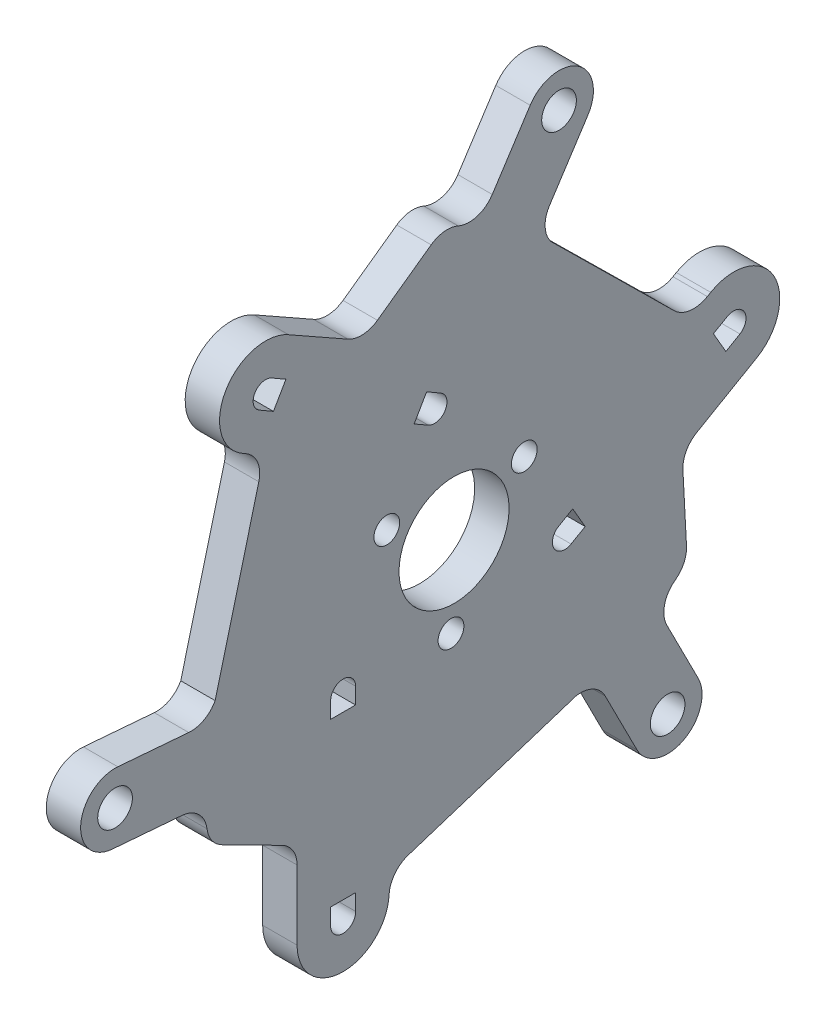
from build123d import *

# Parameters (mm, degrees)
BOSS_EXTRUDE1_DEPTH = 3.175
SKETCH8_W           = 24
SKETCH8_H           = 4.7625
BOSS_EXTRUDE2_DEPTH = 3.175
BOSS_EXTRUDE3_DEPTH = 3.175
CUT_EXTRUDE8_DEPTH  = 3.175
CUT_EXTRUDE7_DEPTH  = 3.175
FILLET1_R           = 2.54
FILLET2_R           = 2.54
SKETCH13_R          = 1.190625
CUT_EXTRUDE9_DEPTH  = 3.175
SKETCH17_R          = 1.6
BOSS_EXTRUDE5_DEPTH = 3.175
FILLET4_R           = 2.54
SKETCH20_R          = 5.08
CUT_EXTRUDE12_DEPTH = 70.976978338


with BuildPart() as part:
    # Sketch1 → Boss-Extrude1 (new body)
    with BuildSketch(Plane(origin=(0, 0, 0), x_dir=(0, 0, -1), z_dir=(1, 0, 0))):
        Polygon((43.890597967, 11.483842091), (31.890597967, 32.268451781), (22.25, 38.538130468), (44.5, 0), align=None)
        Polygon((22.25, 38.538130468), (44.5, 0), (0, 0), align=None)
        Polygon((0.899789316, 11.058480811), (12.899789316, 31.843090502), (22.25, 38.538130468), (0, 0), align=None)
        Polygon((10.25, -5.214163404), (34.25, -5.214163404), (44.5, 0), (0, 0), align=None)
    extrude(amount=BOSS_EXTRUDE1_DEPTH)

    # Sketch8 → Boss-Extrude2 (add)
    with BuildSketch(Plane.ZY):
        Polygon((-43.890597967, 11.483842091), (-31.890597967, 32.268451781), (-36.015043953, 34.649701781), (-48.015043953, 13.865092091), align=None)
        with Locations((-22.25, -7.595413404)):
            Rectangle(SKETCH8_W, SKETCH8_H)
        Polygon((-12.899789316, 31.843090502), (-0.899789316, 11.058480811), (3.22465667, 13.439730811), (-8.77534333, 34.224340502), align=None)
    extrude(amount=-BOSS_EXTRUDE2_DEPTH)

    # Sketch9 → Boss-Extrude3 (add)
    # profile 1 of 3: a face of its own
    with BuildSketch(Plane(origin=(3.175, 0, 0), x_dir=(0, 0, -1), z_dir=(1, 0, 0))):
        with BuildLine():
            Line((3.432653779, 29.558030749), (5.419099548, 28.411155749))
            Line((5.419099548, 28.411155749), (8.77534333, 34.224340502))
            Line((8.77534333, 34.224340502), (12.899789316, 31.843090502))
            Line((12.899789316, 31.843090502), (14.562601584, 33.033715502))
            Line((14.562601584, 33.033715502), (7.682653779, 36.919246681))
            ThreePointArc((7.682653779, 36.919246681), (1.877045812, 35.363638715), (3.432653779, 29.558030749))
        make_face()
        with BuildLine():
            Line((4.98264756, 32.24269873), (6.281769095, 31.492650563))
            Line((6.281769095, 31.492650563), (7.43173356, 33.484529507))
            Line((7.43173356, 33.484529507), (6.13264756, 34.234557159))
            ThreePointArc((6.13264756, 34.234557159), (4.561718346, 33.813627945), (4.98264756, 32.24269873))
        make_face(mode=Mode.SUBTRACT)
    # profile 2 of 3: a face of its own
    with BuildSketch(Plane(origin=(3.175, 0, 0), x_dir=(0, 0, -1), z_dir=(1, 0, 0))):
        with BuildLine():
            Line((8.462487563, -12.270413404), (8.462487563, -4.304857849))
            Line((8.462487563, -4.304857849), (10.25, -5.214163404))
            Line((10.25, -5.214163404), (10.25, -9.976663404))
            Line((10.25, -9.976663404), (20.606380555, -9.976663404))
            Line((20.606380555, -9.976663404), (20.606380555, -10.770413404))
            Line((20.606380555, -10.770413404), (16.962487563, -10.770413404))
            Line((16.962487563, -10.770413404), (16.962487563, -12.270413404))
            ThreePointArc((16.962487563, -12.270413404), (12.712487563, -16.520413404), (8.462487563, -12.270413404))
        make_face()
        with BuildLine():
            Line((11.5625, -12.270413404), (11.5625, -10.7703581))
            Line((11.5625, -10.7703581), (13.8625, -10.770317068))
            Line((13.8625, -10.770317068), (13.8625, -12.270413404))
            ThreePointArc((13.8625, -12.270413404), (12.7125, -13.457465158), (11.5625, -12.270413404))
        make_face(mode=Mode.SUBTRACT)
    # profile 3 of 3: a face of its own
    with BuildSketch(Plane(origin=(3.175, 0, 0), x_dir=(0, 0, -1), z_dir=(1, 0, 0))):
        with BuildLine():
            Line((46.645245941, 20.825151843), (44.658800171, 19.678276843))
            Line((44.658800171, 19.678276843), (48.015043953, 13.865092091))
            Line((48.015043953, 13.865092091), (43.890597967, 11.483842091))
            Line((43.890597967, 11.483842091), (43.996871736, 9.481172067))
            Line((43.996871736, 9.481172067), (50.895245941, 13.463935911))
            ThreePointArc((50.895245941, 13.463935911), (52.450853907, 19.269543877), (46.645245941, 20.825151843))
        make_face()
        with BuildLine():
            Line((48.195239723, 18.140483862), (46.896118188, 17.390435694))
            Line((46.896118188, 17.390435694), (48.046153723, 15.398212801))
            Line((48.046153723, 15.398212801), (49.345239723, 16.148625433))
            ThreePointArc((49.345239723, 16.148625433), (49.750491106, 17.710503048), (48.195239723, 18.140483862))
        make_face(mode=Mode.SUBTRACT)
    extrude(amount=-BOSS_EXTRUDE3_DEPTH)

    # Sketch12 → Cut-Extrude8 (cut)
    with BuildSketch(Plane(origin=(3.175, 0, 0), x_dir=(0, 0, -1), z_dir=(1, 0, 0))):
        with BuildLine():
            Line((33.756782454, 7.148625433), (35.055868454, 7.898653085))
            Line((35.055868454, 7.898653085), (33.905903989, 9.89053203))
            Line((33.905903989, 9.89053203), (32.606782454, 9.140483862))
            ThreePointArc((32.606782454, 9.140483862), (32.18585324, 7.569554647), (33.756782454, 7.148625433))
        make_face()
        with BuildLine():
            Line((21.721104828, 25.234557159), (20.422018828, 25.984584811))
            Line((20.422018828, 25.984584811), (19.271959255, 23.992760775))
            Line((19.271959255, 23.992760775), (20.571104828, 23.24269873))
            ThreePointArc((20.571104828, 23.24269873), (22.142034043, 23.663627945), (21.721104828, 25.234557159))
        make_face()
        with BuildLine():
            Line((13.8625, 5.729586596), (13.8625, 4.229490261))
            Line((13.8625, 4.229490261), (11.5625, 4.229531293))
            Line((11.5625, 4.229531293), (11.5625, 5.729586596))
            ThreePointArc((11.5625, 5.729586596), (12.7125, 6.879586596), (13.8625, 5.729586596))
        make_face()
    extrude(amount=-CUT_EXTRUDE8_DEPTH, mode=Mode.SUBTRACT)

    # Sketch10 → Cut-Extrude7 (cut)
    with BuildSketch(Plane(origin=(3.175, 0, 0), x_dir=(0, 0, -1), z_dir=(1, 0, 0))):
        Polygon((31.890597967, 32.268451781), (44.658800171, 19.678276843), (36.015043953, 34.649701781), align=None)
        Polygon((5.419099548, 28.411155749), (0.899789316, 11.058480811), (-3.22465667, 13.439730811), align=None)
        Polygon((16.962487563, -10.770413404), (34.25, -5.214163404), (34.25, -11.414104667), align=None)
    extrude(amount=-CUT_EXTRUDE7_DEPTH, mode=Mode.SUBTRACT)

    # Fillet1
    fillet1_edges = [part.edges().sort_by_distance(p)[0] for p in [
        (1.5875, -10.770413404, -16.962487563),
    ]]
    fillet(fillet1_edges, radius=FILLET1_R)

    # Fillet2
    fillet2_edges = [part.edges().sort_by_distance(p)[0] for p in [
        (1.5875, -4.304857849, -8.462487563),
        (1.5875, 0, -44.5),
        (1.5875, 0, 0),
        (1.5875, 38.538130468, -22.25),
        (1.5875, 33.033715502, -14.562601584),
        (1.5875, 28.411155749, -5.419099548),
        (1.5875, 19.678276843, -44.658800171),
        (1.5875, 9.481172067, -43.996871736),
    ]]
    fillet(fillet2_edges, radius=FILLET2_R)

    # Sketch13 → Cut-Extrude9 (cut)
    with BuildSketch(Plane.ZY):
        with BuildLine():
            ThreePointArc((-15.555361616, 16.777538207), (-16.768661404, 17.967947273), (-17.935747959, 16.732196856))
            Line((-17.935747959, 16.732196856), (-16.745986616, 16.777538207))
            Line((-16.745986616, 16.777538207), (-17.301600526, 15.724503984))
            ThreePointArc((-17.301600526, 15.724503984), (-16.131145141, 15.757951109), (-15.555361616, 16.777538207))
        make_face()
        with BuildLine():
            Line((-16.745986616, 16.777538207), (-17.935747959, 16.732196856))
            ThreePointArc((-17.935747959, 16.732196856), (-17.753679488, 16.143390774), (-17.301600526, 15.724503984))
            Line((-17.301600526, 15.724503984), (-16.745986616, 16.777538207))
        make_face()
        with Locations((-22.672534986, 5.545173165)):
            Circle(SKETCH13_R)
        with Locations((-29.436774271, 16.293897131)):
            Circle(SKETCH13_R)
    extrude(amount=-CUT_EXTRUDE9_DEPTH, mode=Mode.SUBTRACT)

    # Sketch17 → Boss-Extrude5 (add)
    # profile 1 of 3: a face of its own
    with BuildSketch(Plane.ZY):
        with BuildLine():
            Line((-35.808950658, -4.421126968), (-39.839725672, -12.34482262))
            ThreePointArc((-39.839725672, -12.34482262), (-44.109179481, -13.735151419), (-45.499508281, -9.46569761))
            Line((-45.499508281, -9.46569761), (-41.468733267, -1.542001958))
            Line((-41.468733267, -1.542001958), (-35.808950658, -4.421126968))
        make_face()
        with Locations((-42.669616976, -10.905260115)):
            Circle(SKETCH17_R, mode=Mode.SUBTRACT)
    # profile 2 of 3: a face of its own
    with BuildSketch(Plane.ZY):
        with BuildLine():
            Line((-0.261472593, 3.213518539), (8.599244609, 3.934483634))
            ThreePointArc((8.599244609, 3.934483634), (11.506298933, 7.356513026), (8.084269542, 10.26356735))
            Line((8.084269542, 10.26356735), (-0.77644766, 9.542602255))
            Line((-0.77644766, 9.542602255), (-0.261472593, 3.213518539))
        make_face()
        with Locations((8.341757075, 7.099025492)):
            Circle(SKETCH17_R, mode=Mode.SUBTRACT)
    # profile 3 of 3: a face of its own
    with BuildSketch(Plane.ZY):
        with BuildLine():
            Line((-25.13548002, 36.661583739), (-29.98221424, 44.114185124))
            ThreePointArc((-29.98221424, 44.114185124), (-34.374834099, 45.044851969), (-35.305500944, 40.65223211))
            Line((-35.305500944, 40.65223211), (-30.458766724, 33.199630725))
            Line((-30.458766724, 33.199630725), (-25.13548002, 36.661583739))
        make_face()
        with Locations((-32.643857592, 42.383208617)):
            Circle(SKETCH17_R, mode=Mode.SUBTRACT)
    extrude(amount=-BOSS_EXTRUDE5_DEPTH)

    # Fillet4
    # the kernel refuses this fillet: 2.54 mm, written as the material it adds along each edge
    with BuildSketch(Plane(origin=(0, 36.661583739, -25.13548002), x_dir=(0, 0.5315830218036889, 0.8470061929703104), z_dir=(1, 0, 0))) as fillet4_piece_1:
        with BuildLine():
            CenterArc((2.499765737, -2.512091747), FILLET4_R, 98.501304121, 80.573560632)
            Line((-0.039903163, -2.471081023), (-0.293870053, -2.46697995))
            Line((-0.293870053, -2.46697995), (-0.25396689, 0.004101072))
            Line((-0.25396689, 0.004101072), (0.004101072, 0.25396689))
            ThreePointArc((0.004101072, 0.25396689), (1.711869919, 0.226389737), (2.086723346, 0.251209175))
            Line((2.086723346, 0.251209175), (2.124272654, 0))
        make_face()
    extrude(amount=3.175)
    with BuildSketch(Plane(origin=(0, 33.199630725, -30.458766724), x_dir=(0, -0.5451894510403108, -0.838312866699757), z_dir=(1, 0, 0))) as fillet4_piece_2:
        with BuildLine():
            CenterArc((2.54, 2.399867047), FILLET4_R, 180, 70.879109992)
            Line((0, 2.399867047), (-0.0508, 2.399867047))
            Line((-0.0508, 2.399867047), (-0.0508, 0))
            Line((-0.0508, 0), (0, -0.0508))
            ThreePointArc((0, -0.0508), (0.853995746, -0.0508), (1.691351321, -0.047997341))
            Line((1.691351321, -0.047997341), (1.707991491, 0))
        make_face()
    extrude(amount=3.175)
    with BuildSketch(Plane(origin=(0, -1.542001958, -41.468733267), x_dir=(0, 0.466230647669412, -0.8846632032439015), z_dir=(1, 0, 0))) as fillet4_piece_3:
        with BuildLine():
            CenterArc((2.503946527, -2.514474671), FILLET4_R, 98.12963068, 81.042861753)
            Line((-0.035788565, -2.477791408), (-0.289762074, -2.474123082))
            Line((-0.289762074, -2.474123082), (-0.253973509, 0.003668326))
            Line((-0.253973509, 0.003668326), (0.003668326, 0.253973509))
            ThreePointArc((0.003668326, 0.253973509), (1.752552501, 0.228713088), (2.108838028, 0.251447467))
            Line((2.108838028, 0.251447467), (2.144756982, 0))
        make_face()
    extrude(amount=3.175)
    with BuildSketch(Plane(origin=(0, -4.421126968, -35.808950658), x_dir=(0, -0.4534055133611399, 0.8913043478261066), z_dir=(1, 0, 0))) as fillet4_piece_4:
        with BuildLine():
            CenterArc((2.54, 2.413715879), FILLET4_R, 180, 71.856915027)
            Line((0, 2.413715879), (-0.0508, 2.413715879))
            Line((-0.0508, 2.413715879), (-0.0508, 0))
            Line((-0.0508, 0), (0, -0.0508))
            ThreePointArc((0, -0.0508), (0.874533296, -0.0508), (1.733247924, -0.048274318))
            Line((1.733247924, -0.048274318), (1.749066592, 0))
        make_face()
    extrude(amount=3.175)
    with BuildSketch(Plane(origin=(0, 9.542602255, -0.77644766), x_dir=(0, 0.9967060969511591, -0.08109843586892752), z_dir=(1, 0, 0))) as fillet4_piece_5:
        with BuildLine():
            CenterArc((2.54, 2.326587881), FILLET4_R, 180, 66.345211462)
            Line((0, 2.326587881), (-0.0508, 2.326587881))
            Line((-0.0508, 2.326587881), (-0.0508, 0))
            Line((-0.0508, 0), (0, -0.0508))
            ThreePointArc((0, -0.0508), (0.760444107, -0.0508), (1.500505979, -0.046531758))
            Line((1.500505979, -0.046531758), (1.520888214, 0))
        make_face()
    extrude(amount=3.175)
    with BuildSketch(Plane(origin=(0, 3.213518539, -0.261472593), x_dir=(0, -0.9984457063976324, 0.05573303666706552), z_dir=(1, 0, 0))) as fillet4_piece_6:
        with BuildLine():
            CenterArc((2.477230301, -2.500513603), FILLET4_R, 100.115998519, 78.42721807)
            Line((-0.061948733, -2.435939367), (-0.315866636, -2.429481943))
            Line((-0.315866636, -2.429481943), (-0.253917903, 0.006457424))
            Line((-0.253917903, 0.006457424), (0.006457424, 0.253917903))
            ThreePointArc((0.006457424, 0.253917903), (1.526854064, 0.215252472), (1.986487618, 0.25005136))
            Line((1.986487618, 0.25005136), (2.031100589, 0))
        make_face()
    extrude(amount=3.175)

    # Sketch20 → Cut-Extrude12 (cut, through all)
    with BuildSketch(Plane.ZY):
        with Locations((-22.951765291, 12.872202834)):
            Circle(SKETCH20_R)
    extrude(amount=-CUT_EXTRUDE12_DEPTH, mode=Mode.SUBTRACT)


solid = part.part
